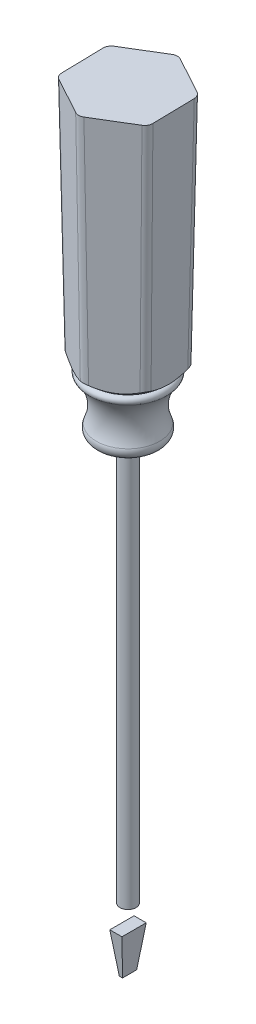
from build123d import *

# Parameters (mm, degrees)
EXTRUDE_1_DEPTH = 60
DRAFT_1_ANGLE   = 1
FILLET_1_R      = 2
SKETCH_4_R      = 2
EXTRUDE_2_DEPTH = 100


# Read off the part's stored shape, not the designer's step: 切除-旋转-薄壁1
with BuildPart() as part:
    # 草图1 → 凸台-拉伸1 (new body)
    with BuildSketch(Plane(origin=(0, 0, 0), x_dir=(1, 0, 0), z_dir=(0, 1, 0))):
        Polygon((0.244326354, -11.544420209), (10.11992435, -5.560617276), (9.875597996, 5.983802934), (-0.244326354, 11.544420209), (-10.11992435, 5.560617276), (-9.875597996, -5.983802934), align=None)
    extrude(amount=EXTRUDE_1_DEPTH)

    # 拔模1
    draft_1_faces = [part.faces().sort_by_distance(p)[0] for p in [
        (-9.997761173, 30, 0.211592829),
        (-4.815635821, 30, 8.764111571),
        (5.182125352, 30, 8.552518742),
        (9.997761173, 30, -0.211592829),
        (4.815635821, 30, -8.764111571),
        (-5.182125352, 30, -8.552518742),
    ]]
    draft(draft_1_faces, Plane(origin=(0, 0, 0), x_dir=(0, 0, -1), z_dir=(0, -1, 0)), DRAFT_1_ANGLE)

    # 切除-旋转-薄壁1 outline → 切除-旋转-薄壁1 (revolve, cut)
    with BuildSketch(Plane.XY):
        Polygon((11.593936647, 2.32828054), (8.8, 0), (11.593936647, 0), align=None)
    revolve(axis=Axis((0, 0, 0), (0, 1, 0)), mode=Mode.SUBTRACT)

    # 圆角1
    fillet_1_edges = [part.edges().sort_by_distance(p)[0] for p in [
        (-0.257617025, 31.164138617, -12.172404417),
        (10.412802938, 31.164138617, -6.309305096),
        (10.670419963, 31.164138617, 5.863099321),
        (-10.670419963, 31.164138617, -5.863099321),
        (0.257617025, 31.164138617, 12.172404417),
        (-10.412802938, 31.164138617, 6.309305096),
    ]]
    fillet(fillet_1_edges, radius=FILLET_1_R)

    # 草图3 → 旋转1 (revolve)
    with BuildSketch(Plane.XY, mode=Mode.PRIVATE) as revolve_1_sk:
        with BuildLine():
            Line((0, -15), (-6, -15))
            ThreePointArc((-6, -15), (-7.668814978, -14.102296044), (-7.839528148, -12.215056568))
            ThreePointArc((-7.839528148, -12.215056568), (-7.165836652, -6.691339771), (-9.548833535, -1.662758128))
            ThreePointArc((-9.548833535, -1.662758128), (-9.711799903, -0.589365204), (-8.8, 0))
            Line((-8.8, 0), (0, 0))
            Line((0, 0), (0, -15))
        make_face()
    revolve(revolve_1_sk.sketch.rotate(Axis((0, 0, 0), (0, -1, 0)), 270), axis=Axis((0, 0, 0), (0, -1, 0)))

    # 草图4 → 凸台-拉伸2 (add)
    with BuildSketch(Plane(origin=(0, -15, 0), x_dir=(-1, 0, 0), z_dir=(0, -1, 0))):
        with Locations(Location((0, 0, 0), (0, 0, 90))):
            Circle(SKETCH_4_R)
    extrude(amount=EXTRUDE_2_DEPTH)


with BuildPart() as body_2:
    # 草图6 → 放样1 section 0
    with BuildSketch(Plane(origin=(0, -120, 0), x_dir=(-1, 0, 0), z_dir=(0, -1, 0))):
        with BuildLine():
            Line((1.5, 3), (-1.5, 3))
            Line((-1.5, 3), (-1.5, -3))
            Line((-1.5, -3), (1.5, -3))
            Line((1.5, -3), (1.5, 3))
        make_face()
    # 草图7 → 放样1 section 1
    with BuildSketch(Plane(origin=(0, -130, 0), x_dir=(-1, 0, 0), z_dir=(0, -1, 0))):
        with BuildLine():
            Line((-0.4, 1.75), (0.4, 1.75))
            Line((0.4, 1.75), (0.4, -1.75))
            Line((0.4, -1.75), (-0.4, -1.75))
            Line((-0.4, -1.75), (-0.4, 1.75))
        make_face()
    loft()


solid = Compound([part.part, body_2.part])
